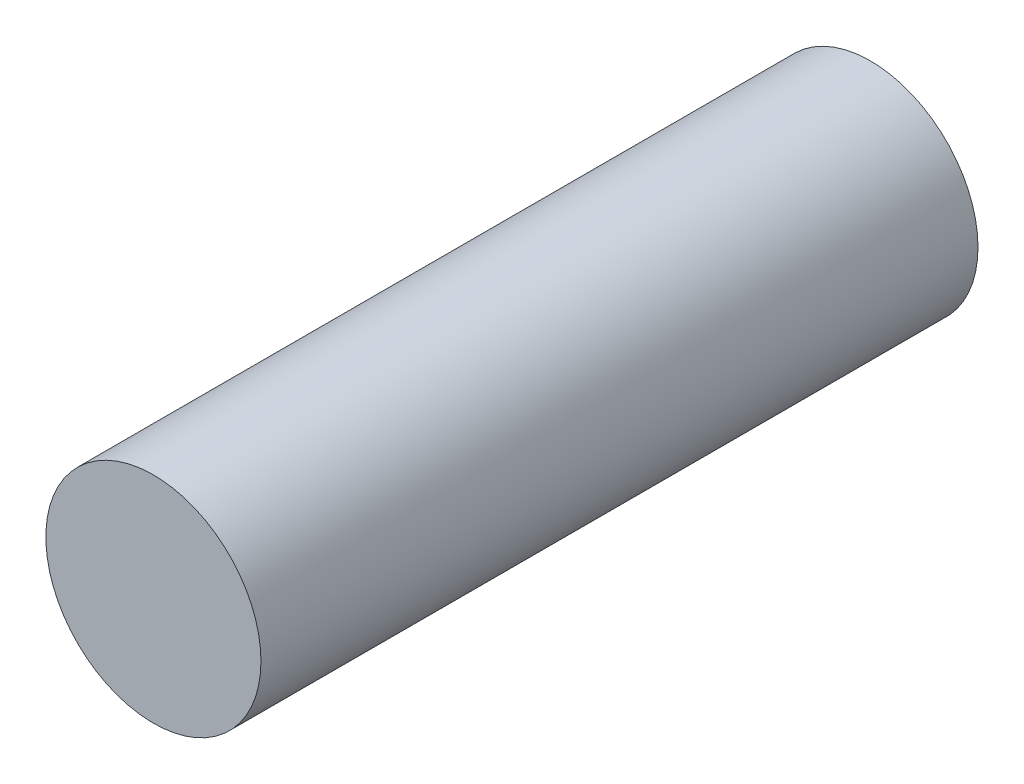
from build123d import *

# Parameters (mm, degrees)
BOSS_EXTRUDE1_DEPTH      = 35
BOSS_EXTRUDE1_DEPTH_BACK = 35
SKETCH2_R                = 10.5


with BuildPart() as part:
    # Sketch2 → Boss-Extrude1 (new, two sides: drawn at the far end of the back side and taken through both)
    with BuildSketch(Plane(origin=(0, 0, 0), x_dir=(0, 1, 0), z_dir=(0, 0, 1)).offset(-BOSS_EXTRUDE1_DEPTH_BACK)):
        Circle(SKETCH2_R)
    extrude(amount=BOSS_EXTRUDE1_DEPTH + BOSS_EXTRUDE1_DEPTH_BACK)


solid = part.part
